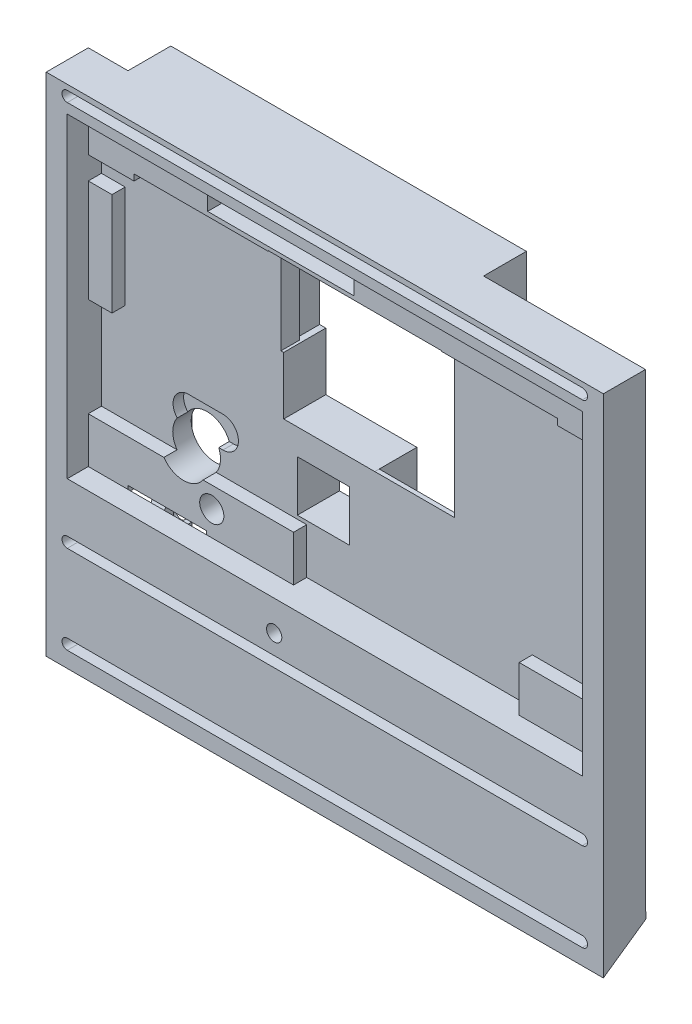
from build123d import *
from OCP.BRepFilletAPI import BRepFilletAPI_MakeChamfer

# Parameters (mm, degrees)
SKETCH1_W                       = 67.57
SKETCH1_H                       = 82.04
SKETCH1_W_2                     = 59.57
SKETCH1_H_2                     = 74.04
BOSS_EXTRUDE1_DEPTH             = 12.13
SKETCH2_W                       = 5.056332521
SKETCH2_H                       = 8.11
SKETCH2_W_2                     = 9.886324902
SKETCH2_H_2                     = 9.628245149
SKETCH2_W_3                     = 4.14
SKETCH2_H_3                     = 7
BOSS_EXTRUDE2_DEPTH             = 10.5
SKETCH3_R                       = 3.295
SKETCH3_W                       = 5.07
SKETCH3_H                       = 8.08
CUT_EXTRUDE1_DEPTH              = 4
SKETCH4_R                       = 4.538968619
SKETCH4_R_2                     = 2.296660374
BOSS_EXTRUDE3_DEPTH             = 6
SKETCH6_W                       = 4.2
SKETCH6_H                       = 5.9
CUT_EXTRUDE2_DEPTH              = 4
SKETCH5_W                       = 15.17
SKETCH5_H                       = 32.216758372
BOSS_EXTRUDE5_DEPTH             = 3.33
CUT_EXTRUDE3_DEPTH              = 4.5
SKETCH8_W                       = 3.54
SKETCH8_H                       = 60.01
SKETCH8_W_2                     = 26.76
BOSS_EXTRUDE6_DEPTH             = 4
SKETCH8_3_W                     = 105.87
SKETCH8_3_H                     = 82.04
SKETCH8_3_W_2                   = 97.87
SKETCH8_3_H_2                   = 60.01
BOSS_EXTRUDE7_DEPTH             = 4
SKETCH9_R                       = 1.449406475
CUT_EXTRUDE4_DEPTH              = 14.5
SKETCH10_W                      = 9.886324902
SKETCH10_H                      = 9.628245149
CUT_EXTRUDE5_DEPTH              = 2.5
SKETCH11_W                      = 16.344018588
SKETCH11_H                      = 10.97
CUT_EXTRUDE6_DEPTH              = 12.78
CUT_EXTRUDE7_START              = -10.104556
SKETCH12_R                      = 5
CUT_EXTRUDE7_DEPTH              = 10.104556
SKETCH13_W                      = 5.5
SKETCH13_H                      = 11
CUT_EXTRUDE8_DEPTH              = 2
CHAMFER1_SIZE                   = 0.352653961
CHAMFER1_SIZE_2                 = 2
SKETCH15_W                      = 8.13
SKETCH15_H                      = 12.312258352
CUT_EXTRUDE9_DEPTH              = 3.75
CHAMFER2_SIZE                   = 6.92820323
CHAMFER2_SIZE_2                 = 4
FILLET1_R                       = 10
CUT_EXTRUDE10_DEPTH             = 2
BOSS_EXTRUDE8_REACH             = 131.072
BOSS_EXTRUDE8_DIRECTION_2_REACH = 131.072
BOSS_EXTRUDE9_DEPTH             = 67.57
SKETCH22_R                      = 1
CUT_EXTRUDE11_DEPTH             = 15
BOSS_EXTRUDE10_REACH            = 137.716
CUT_EXTRUDE14_REACH             = 129.823
CUT_EXTRUDE14_END_RADIUS        = 1
SKETCH25_W                      = 11
SKETCH25_H                      = 2
CUT_EXTRUDE15_DEPTH             = 9.047267
CUT_EXTRUDE17_DEPTH             = 2


# Some blends are built 0.0001 mm under size
with BuildPart() as part:
    # Sketch1 → Boss-Extrude1 (new body)
    with BuildSketch(Plane.XY):
        with Locations((33.785, 41.02)):
            Rectangle(SKETCH1_W, SKETCH1_H)
        with Locations((33.785, 41.02)):
            Rectangle(SKETCH1_W_2, SKETCH1_H_2, mode=Mode.SUBTRACT)
    extrude(amount=BOSS_EXTRUDE1_DEPTH)

    # Sketch2 → Boss-Extrude2 (add)
    # profile 1 of 3: a face of its own
    with BuildSketch(Plane.XY.offset(12.13)):
        Polygon((63.57, 4), (63.57, 8.81), (48.4, 8.81), (48.4, 41.02), (31.09, 41.02), (31.09, 42.65), (31.09, 51.980736011), (29.91, 51.980736011), (29.91, 69.76), (46.97, 69.76), (63.57, 69.76), (63.57, 78.04), (46.97, 78.04), (46.97, 70.46), (19.884173984, 70.46), (19.884173984, 65.974782106), (23.4, 65.974782106), (23.4, 62.189564213), (19.884173984, 62.189564213), (19.884173984, 57.7), (17.69, 57.7), (17.69, 55.75345319), (12.048971612, 55.75345319), (12.048971612, 53.7), (9.384343354, 53.7), (9.384343354, 57.7), (4, 57.7), (4, 52.67), (21.97, 52.67), (21.97, 57.934249496), (27.48, 57.934249496), (27.48, 52.67), (27.48, 41.02), (21.97, 41.02), (21.97, 25.27), (30.576891618, 25.27), (30.576891618, 8.81), (18.908573992, 8.81), (18.908573992, 4), align=None)
        with Locations((35.59281061, 12.865)):
            Rectangle(SKETCH2_W, SKETCH2_H, mode=Mode.SUBTRACT)
        with Locations((38.626837549, 31.304322193)):
            Rectangle(SKETCH2_W_2, SKETCH2_H_2, mode=Mode.SUBTRACT)
    # profile 2 of 3: a face of its own
    with BuildSketch(Plane.XY.offset(12.13)):
        with Locations((17.07, 74.54)):
            Rectangle(SKETCH2_W_3, SKETCH2_H_3)
    # profile 3 of 3: a face of its own
    with BuildSketch(Plane.XY.offset(12.13)):
        with BuildLine():
            Line((4, 36.69), (4, 30.56))
            Line((4, 30.56), (10.54, 30.56))
            ThreePointArc((10.54, 30.56), (12.890078171, 32.732190681), (16.09, 32.69))
            Line((16.09, 32.69), (16.09, 36.69))
            Line((16.09, 36.69), (4, 36.69))
        make_face()
    extrude(amount=-BOSS_EXTRUDE2_DEPTH)

    # Sketch3 → Cut-Extrude1 (cut)
    with BuildSketch(Plane.ZY):
        with Locations((8.175, 12.315)):
            Circle(SKETCH3_R)
        with Locations((2.535, 64.62)):
            Rectangle(SKETCH3_W, SKETCH3_H)
    extrude(amount=-CUT_EXTRUDE1_DEPTH, mode=Mode.SUBTRACT)

    # Sketch4 → Boss-Extrude3 (add)
    with BuildSketch(Plane.XY.offset(12.13)):
        Polygon((4, 70.46), (14.88607029, 70.46), (15, 78.04), (19.14, 78.04), (19.14, 70.46), (30.576891618, 70.46), (30.576891618, 4), (4, 4), (4, 6.83), (18.908573992, 6.83), (18.908573992, 17.8), (4, 17.8), align=None)
        with Locations((14.544107927, 28.422394838)):
            Circle(SKETCH4_R, mode=Mode.SUBTRACT)
        with Locations((19.919655023, 21.845034344)):
            Circle(SKETCH4_R_2, mode=Mode.SUBTRACT)
    extrude(amount=-BOSS_EXTRUDE3_DEPTH)

    # Sketch6 → Cut-Extrude2 (cut)
    with BuildSketch(Plane(origin=(67.57, 0, 0), x_dir=(0, 0, -1), z_dir=(1, 0, 0))):
        with Locations((-4.55, 15.67)):
            Rectangle(SKETCH6_W, SKETCH6_H)
    extrude(amount=-CUT_EXTRUDE2_DEPTH, mode=Mode.SUBTRACT)

    # Sketch5 → Boss-Extrude5 (add)
    with BuildSketch(Plane.XY.offset(12.13)):
        with Locations((55.985, 24.918379186)):
            Rectangle(SKETCH5_W, SKETCH5_H)
    extrude(amount=-BOSS_EXTRUDE5_DEPTH)

    # Sketch7 → Cut-Extrude3 (cut)
    with BuildSketch(Plane.XY.offset(12.13)):
        with BuildLine():
            Line((19.54, 30.142877743), (13.02, 30.142877743))
            ThreePointArc((13.02, 30.142877743), (10.072877743, 33.09), (13.02, 36.037122257))
            Line((13.02, 36.037122257), (19.54, 36.037122257))
            ThreePointArc((19.54, 36.037122257), (22.487122257, 33.09), (19.54, 30.142877743))
        make_face()
    extrude(amount=-CUT_EXTRUDE3_DEPTH, mode=Mode.SUBTRACT)

    # Sketch8 → Boss-Extrude6 (add)
    with BuildSketch(Plane.XY.offset(12.13)):
        Polygon((-3.54, 77.14), (0, 77.14), (0, 82.04), (-7.54, 82.04), (-7.54, 0), (0, 0), (0, 17.13), (-3.54, 17.13), align=None)
        with Locations((-1.77, 47.135)):
            Rectangle(SKETCH8_W, SKETCH8_H)
        Polygon((98.33, 82.04), (67.57, 82.04), (67.57, 77.14), (94.33, 77.14), (94.33, 17.13), (67.57, 17.13), (67.57, 0), (98.33, 0), align=None)
        with Locations((80.95, 47.135)):
            Rectangle(SKETCH8_W_2, SKETCH8_H)
    extrude(amount=-BOSS_EXTRUDE6_DEPTH)

    # Sketch8<3> → Boss-Extrude7 (add)
    with BuildSketch(Plane.XY.offset(12.13)):
        with Locations((45.395, 41.02)):
            Rectangle(SKETCH8_3_W, SKETCH8_3_H)
        with Locations((45.395, 47.135)):
            Rectangle(SKETCH8_3_W_2, SKETCH8_3_H_2, mode=Mode.SUBTRACT)
    extrude(amount=BOSS_EXTRUDE7_DEPTH)

    # Sketch9 → Cut-Extrude4 (cut)
    with BuildSketch(Plane.XY.offset(16.13)):
        with Locations((35.780517138, 11.382044907)):
            Circle(SKETCH9_R)
    extrude(amount=-CUT_EXTRUDE4_DEPTH, mode=Mode.SUBTRACT)

    # Sketch10 → Cut-Extrude5 (cut)
    with BuildSketch(Plane.XY.offset(12.13)):
        with BuildLine():
            Line((5.15, 68.45), (-3.54, 68.45))
            Line((-3.54, 68.45), (-3.54, 64.13))
            Line((-3.54, 64.13), (0.96, 64.13))
            Line((0.96, 64.13), (0.96, 44.63))
            Line((0.96, 44.63), (-3.54, 44.63))
            Line((-3.54, 44.63), (-3.54, 25.82))
            Line((-3.54, 25.82), (10.825267082, 25.82))
            ThreePointArc((10.825267082, 25.82), (10.005266117, 28.456323299), (10.864586998, 31.080093438))
            ThreePointArc((10.864586998, 31.080093438), (10.317318927, 34.265178547), (13.02, 36.037122257))
            Line((13.02, 36.037122257), (19.54, 36.037122257))
            ThreePointArc((19.54, 36.037122257), (22.487122257, 33.09), (19.54, 30.142877743))
            Line((19.54, 30.142877743), (18.744366811, 30.142877743))
            ThreePointArc((18.744366811, 30.142877743), (19.055189075, 27.920017493), (18.262948772, 25.82))
            Line((18.262948772, 25.82), (35.46, 25.82))
            Line((35.46, 25.82), (35.46, 17.13))
            Line((35.46, 17.13), (78.33, 17.13))
            Line((78.33, 17.13), (78.33, 25.82))
            Line((78.33, 25.82), (94.33, 25.82))
            Line((94.33, 25.82), (94.33, 35.13))
            Line((94.33, 35.13), (91.33, 35.13))
            Line((91.33, 35.13), (91.33, 47.135))
            Line((91.33, 47.135), (91.33, 57.13))
            Line((91.33, 57.13), (94.33, 57.13))
            Line((94.33, 57.13), (94.33, 68.45))
            Line((94.33, 68.45), (85.64, 68.45))
            Line((85.64, 68.45), (85.64, 69.64))
            Line((85.64, 69.64), (63.57, 69.64))
            Line((63.57, 69.64), (63.57, 41.026758372))
            Line((63.57, 41.026758372), (48.4, 41.026758372))
            Line((48.4, 41.026758372), (48.4, 41.02))
            Line((48.4, 41.02), (31.09, 41.02))
            Line((31.09, 41.02), (31.09, 51.980736011))
            Line((31.09, 51.980736011), (30.576891618, 51.980736011))
            Line((30.576891618, 51.980736011), (30.576891618, 69.64))
            Line((30.576891618, 69.64), (5.15, 69.64))
            Line((5.15, 69.64), (5.15, 68.45))
        make_face()
        with Locations((38.626837549, 31.304322193)):
            Rectangle(SKETCH10_W, SKETCH10_H, mode=Mode.SUBTRACT)
    extrude(amount=-CUT_EXTRUDE5_DEPTH, mode=Mode.SUBTRACT)

    # Sketch11 → Cut-Extrude6 (cut)
    with BuildSketch(Plane(origin=(0, 0, 0), x_dir=(-1, 0, 0), z_dir=(0, 0, -1))):
        with Locations((-10.736564698, 11.18)):
            Rectangle(SKETCH11_W, SKETCH11_H)
    extrude(amount=-CUT_EXTRUDE6_DEPTH, mode=Mode.SUBTRACT)

    # Sketch12 → Cut-Extrude7 (cut)
    with BuildSketch(Plane.ZY.offset(7.54).offset(CUT_EXTRUDE7_START)):
        with Locations(Location((8.13, 11.18, 0), (0, 0, 338.434814985))):
            Circle(SKETCH12_R)
    extrude(amount=CUT_EXTRUDE7_DEPTH, mode=Mode.SUBTRACT)

    # Sketch13 → Cut-Extrude8 (cut)
    with BuildSketch(Plane.ZY):
        with Locations((3.35, 64.62)):
            Rectangle(SKETCH13_W, SKETCH13_H)
    extrude(amount=-CUT_EXTRUDE8_DEPTH, mode=Mode.SUBTRACT)

    # Chamfer1
    chamfer1_edges_1 = [part.edges().sort_by_distance(p)[0] for p in [
        (0, 59.85, 0.6),
    ]]
    chamfer1_side_1 = [part.faces().sort_by_distance(p)[0] for p in [
        (0, 59.85, 0.592946921),
    ]]
    chamfer1_edges_2 = [part.edges().sort_by_distance(p)[0] for p in [
        (0, 69.39, 0.6),
    ]]
    chamfer1_side_2 = [part.faces().sort_by_distance(p)[0] for p in [
        (0, 69.39, 0.592946921),
    ]]
    chamfer1_edges_3 = [part.edges().sort_by_distance(p)[0] for p in [
        (0, 70.12, 3.35),
    ]]
    chamfer1_side_3 = [part.faces().sort_by_distance(p)[0] for p in [
        (0, 70.127053079, 3.35),
    ]]
    chamfer1_edges_4 = [part.edges().sort_by_distance(p)[0] for p in [
        (0, 59.12, 3.35),
    ]]
    chamfer1_side_4 = [part.faces().sort_by_distance(p)[0] for p in [
        (0, 59.112946921, 3.35),
    ]]
    chamfer1_edges_5 = [part.edges().sort_by_distance(p)[0] for p in [
        (0, 64.62, 6.1),
    ]]
    chamfer1_side_5 = [part.faces().sort_by_distance(p)[0] for p in [
        (0, 64.62, 6.107053079),
    ]]
    chamfer1 = BRepFilletAPI_MakeChamfer(part.part.solid().wrapped)
    for e in chamfer1_edges_1:
        chamfer1.Add(CHAMFER1_SIZE - 0.0001, CHAMFER1_SIZE_2 - 0.0001, e.wrapped, chamfer1_side_1[0].wrapped)
    for e in chamfer1_edges_2:
        chamfer1.Add(CHAMFER1_SIZE - 0.0001, CHAMFER1_SIZE_2 - 0.0001, e.wrapped, chamfer1_side_2[0].wrapped)
    for e in chamfer1_edges_3:
        chamfer1.Add(CHAMFER1_SIZE - 0.0001, CHAMFER1_SIZE_2 - 0.0001, e.wrapped, chamfer1_side_3[0].wrapped)
    for e in chamfer1_edges_4:
        chamfer1.Add(CHAMFER1_SIZE - 0.0001, CHAMFER1_SIZE_2 - 0.0001, e.wrapped, chamfer1_side_4[0].wrapped)
    for e in chamfer1_edges_5:
        chamfer1.Add(CHAMFER1_SIZE - 0.0001, CHAMFER1_SIZE_2 - 0.0001, e.wrapped, chamfer1_side_5[0].wrapped)
    add(Compound.cast(chamfer1.Shape()), mode=Mode.REPLACE)  # a hair under: the kernel refuses the full size

    # Sketch15 → Cut-Extrude9 (cut)
    with BuildSketch(Plane(origin=(67.57, 0, 0), x_dir=(0, 0, -1), z_dir=(1, 0, 0))):
        with Locations((-4.065, 15.67)):
            Rectangle(SKETCH15_W, SKETCH15_H)
    extrude(amount=-CUT_EXTRUDE9_DEPTH, mode=Mode.SUBTRACT)

    # Chamfer2
    # the kernel refuses this chamfer: 6.92820323, 4 mm, written as the material it takes off along each edge
    with BuildSketch(Plane(origin=(67.57, 21.826129176, 8.13), x_dir=(0.019326765612699703, 0.9998132206222079, 0), z_dir=(0, 0, -1))) as chamfer2_piece_1_section:
        Polygon((CHAMFER2_SIZE * 0.999813220662, -CHAMFER2_SIZE * 0.0193267656135), (-CHAMFER2_SIZE_2 * 0.0193267656127, -CHAMFER2_SIZE_2 * 0.999813220622), (0, 0), align=None)
    chamfer2_piece_1 = extrude(amount=26.053855882, mode=Mode.PRIVATE)
    chamfer2_piece_1 = split(chamfer2_piece_1, bisect_by=Plane(origin=(63.82, 24.144020698, 4.065), z_dir=(1, 0, 0)), keep=Keep.TOP, mode=Mode.PRIVATE)
    add(chamfer2_piece_1, mode=Mode.SUBTRACT)
    with BuildSketch(Plane(origin=(67.57, 9.513870824, -17.923855882), x_dir=(-0.9983227437537926, 0.05789386240267147, 0), z_dir=(0, 0, 1))) as chamfer2_piece_2_section:
        Polygon((CHAMFER2_SIZE_2 * 0.998322743754, CHAMFER2_SIZE_2 * 0.0578938624027), (-CHAMFER2_SIZE * 0.057893862405, CHAMFER2_SIZE * 0.998322743793), (0, 0), align=None)
    chamfer2_piece_2 = extrude(amount=26.053855882, mode=Mode.PRIVATE)
    chamfer2_piece_2 = split(chamfer2_piece_2, bisect_by=Plane(origin=(63.82, 7.195979302, 4.065), z_dir=(1, 0, 0)), keep=Keep.TOP, mode=Mode.PRIVATE)
    add(chamfer2_piece_2, mode=Mode.SUBTRACT)

    # Fillet1
    # the kernel refuses this fillet: 10 mm, written as the material it takes off along each edge
    with BuildSketch(Plane(origin=(67.57, 28.754332406, 8.13), x_dir=(-0.5000000000001512, -0.8660254037843514, 0), z_dir=(0, 0, -1))) as fillet1_piece_1:
        with BuildLine():
            CenterArc((FILLET1_R * 0.267949192431, FILLET1_R), FILLET1_R, 240, 30)
            Line((-FILLET1_R * 0.232050807569, FILLET1_R * 0.133974596216), (0, 0))
            Line((0, 0), (FILLET1_R * 0.267949192431, 0))
        make_face()
    extrude(amount=14.828729811, mode=Mode.SUBTRACT)
    with BuildSketch(Plane(origin=(67.57, 2.585667594, -6.698729811), x_dir=(0, -1, 0), z_dir=(0, 0, 1))) as fillet1_piece_2:
        with BuildLine():
            CenterArc((FILLET1_R * 0.267949192431, -FILLET1_R), FILLET1_R, 90, 30)
            Line((-FILLET1_R * 0.232050807569, -FILLET1_R * 0.133974596216), (0, 0))
            Line((0, 0), (FILLET1_R * 0.267949192431, 0))
        make_face()
    extrude(amount=14.828729811, mode=Mode.SUBTRACT)

    # Sketch18 → Cut-Extrude10 (cut)
    with BuildSketch(Plane(origin=(0, 0, 0), x_dir=(-1, 0, 0), z_dir=(0, 0, -1))):
        with BuildLine():
            Line((-65.57, 81.04), (-2, 81.04))
            ThreePointArc((-2, 81.04), (-1, 80.04), (-2, 79.04))
            Line((-2, 79.04), (-65.57, 79.04))
            ThreePointArc((-65.57, 79.04), (-66.57, 80.04), (-65.57, 81.04))
        make_face()
        with BuildLine():
            Line((-66.57, 28.993934719), (-66.57, 74.588686402))
            ThreePointArc((-66.57, 74.588686402), (-65.57, 75.588686402), (-64.57, 74.588686402))
            Line((-64.57, 74.588686402), (-64.57, 28.993934719))
            ThreePointArc((-64.57, 28.993934719), (-65.57, 27.993934719), (-66.57, 28.993934719))
        make_face()
        with BuildLine():
            Line((-65.57, 1), (-2, 1))
            ThreePointArc((-2, 1), (-1, 2), (-2, 3))
            Line((-2, 3), (-65.57, 3))
            ThreePointArc((-65.57, 3), (-66.57, 2), (-65.57, 1))
        make_face()
        with BuildLine():
            Line((-3, 6.109784189), (-3, 57.767346039))
            ThreePointArc((-3, 57.767346039), (-2, 58.767346039), (-1, 57.767346039))
            Line((-1, 57.767346039), (-1, 6.109784189))
            ThreePointArc((-1, 6.109784189), (-2, 5.109784189), (-3, 6.109784189))
        make_face()
        with BuildLine():
            Line((-1, 71.472653961), (-1, 74.588686402))
            ThreePointArc((-1, 74.588686402), (-2, 75.588686402), (-3, 74.588686402))
            Line((-3, 74.588686402), (-3, 71.472653961))
            ThreePointArc((-3, 71.472653961), (-2, 70.472653961), (-1, 71.472653961))
        make_face()
    extrude(amount=-CUT_EXTRUDE10_DEPTH, mode=Mode.SUBTRACT)

    # Boss-Extrude8: up to this face of the body (flat: up to its plane)
    boss_extrude8_end = Plane(part.part.faces().sort_by_distance((-7.54, 42.919058237, 12.249514283))[0])
    # Sketch21 → Boss-Extrude8 (add, up to the picked face)
    with BuildSketch(Plane.ZY, mode=Mode.PRIVATE) as boss_extrude8_sk1:
        Polygon((16.13, -14.1), (16.13, 0), (8.13, 0), (8.065, -8.45), align=None)
    boss_extrude8_tool1 = split(extrude(boss_extrude8_sk1.sketch, amount=BOSS_EXTRUDE8_REACH, mode=Mode.PRIVATE), bisect_by=boss_extrude8_end, keep=Keep.BOTH, mode=Mode.PRIVATE)
    add(boss_extrude8_tool1.solids().sort_by(Axis((0, -5.764372, 12.447457), (-1, 0, 0)))[0])

    # Boss-Extrude8 direction 2: up to this face of the body (flat: up to its plane)
    boss_extrude8_direction_2_end = Plane(part.part.faces().sort_by_distance((98.33, 41.02, 12.13))[0])
    # Sketch21 → Boss-Extrude8 direction 2 (add, up to the picked face)
    with BuildSketch(Plane.ZY, mode=Mode.PRIVATE) as boss_extrude8_direction_2_sk1:
        Polygon((16.13, -14.1), (16.13, 0), (8.13, 0), (8.065, -8.45), align=None)
    boss_extrude8_direction_2_tool1 = split(extrude(boss_extrude8_direction_2_sk1.sketch, amount=-BOSS_EXTRUDE8_DIRECTION_2_REACH, mode=Mode.PRIVATE), bisect_by=boss_extrude8_direction_2_end, keep=Keep.BOTH, mode=Mode.PRIVATE)
    add(boss_extrude8_direction_2_tool1.solids().sort_by(Axis((0, -5.764372, 12.447457), (1, 0, 0)))[0])

    # Sketch21<3> → Boss-Extrude9 (add)
    with BuildSketch(Plane.ZY):
        Polygon((8.065, -8.45), (8.13, 0), (0, 0), (0, -2.8), align=None)
    extrude(amount=-BOSS_EXTRUDE9_DEPTH)

    # Sketch22 → Cut-Extrude11 (cut)
    with BuildSketch(Plane.ZY):
        with Locations((4.88, 74.54)):
            Circle(SKETCH22_R)
    extrude(amount=-CUT_EXTRUDE11_DEPTH, mode=Mode.SUBTRACT)

    # Boss-Extrude10: up to this face of the body (flat: up to its plane)
    boss_extrude10_end = Plane(part.part.faces().sort_by_distance((9.443035145, 70.46, 9.13))[0])
    # Sketch23 → Boss-Extrude10 (add, up to the picked face)
    with BuildSketch(Plane.XZ.offset(-78.04), mode=Mode.PRIVATE) as boss_extrude10_sk1:
        Polygon((15, 12.13), (15, 2.909475325), (4, 9.047266551), (4, 12.13), align=None)
    boss_extrude10_tool1 = split(extrude(boss_extrude10_sk1.sketch, amount=BOSS_EXTRUDE10_REACH, mode=Mode.PRIVATE), bisect_by=boss_extrude10_end, keep=Keep.BOTH, mode=Mode.PRIVATE)
    add(boss_extrude10_tool1.solids().sort_by(Axis((10.414605, 78.04, 8.799019), (0, -1, 0)))[0])

    # Cut-Extrude14: up to this cylinder (the profile starts outside it)
    cut_extrude14_end = Plane(origin=(5.94, 74.54, 4.88), z_dir=(-1, 0, 0)) * Cylinder(CUT_EXTRUDE14_END_RADIUS, 262.646, mode=Mode.PRIVATE)
    # Sketch24 → Cut-Extrude14 (cut, up to the surface)
    with BuildSketch(Plane(origin=(2, 0, -2), x_dir=(0, -1, 0), z_dir=(0.7071067811865464, 0, -0.7071067811865488)), mode=Mode.PRIVATE) as cut_extrude14_sk1:
        with BuildLine():
            Line((-73.54, -4.864894655), (-73.54, -6.279108217))
            add(Edge.make_bspline(
                [(-75.54, -6.279108217), (-75.54, -6.986214998), (-74.54, -6.986214998), (-73.54, -6.986214998), (-73.54, -6.279108217)],
                knots=[3.141592654, 3.141592654, 3.141592654, 4.71238898, 4.71238898, 6.283185307, 6.283185307, 6.283185307], degree=2, weights=[1, 0.707106781, 1, 0.707106781, 1]))
            Line((-75.54, -6.279108217), (-75.54, -4.864894655))
            add(Edge.make_bspline(
                [(-73.54, -4.864894655), (-73.54, -4.157787873), (-74.54, -4.157787873), (-75.54, -4.157787873), (-75.54, -4.864894655)],
                knots=[0, 0, 0, 1.570796327, 1.570796327, 3.141592654, 3.141592654, 3.141592654], degree=2, weights=[1, 0.707106781, 1, 0.707106781, 1]))
        make_face()
    cut_extrude14_tool1 = extrude(cut_extrude14_sk1.sketch, amount=-CUT_EXTRUDE14_REACH, mode=Mode.PRIVATE) - cut_extrude14_end
    add(cut_extrude14_tool1.solids().sort_by_distance((5.94, 74.54, 1.94))[0], mode=Mode.SUBTRACT)

    # Sketch25 → Cut-Extrude15 (cut)
    with BuildSketch(Plane(origin=(0, 0, 0), x_dir=(-1, 0, 0), z_dir=(0, 0, -1))):
        with Locations((-9.5, 74.54)):
            Rectangle(SKETCH25_W, SKETCH25_H)
    extrude(amount=-CUT_EXTRUDE15_DEPTH, mode=Mode.SUBTRACT)

    # Sketch28 → Cut-Extrude17 (cut)
    with BuildSketch(Plane.XY.offset(16.13)):
        with BuildLine():
            Line((-3.54, 79.04), (94.33, 79.04))
            ThreePointArc((94.33, 79.04), (95.33, 80.04), (94.33, 81.04))
            Line((94.33, 81.04), (-3.54, 81.04))
            ThreePointArc((-3.54, 81.04), (-4.54, 80.04), (-3.54, 79.04))
        make_face()
        with BuildLine():
            Line((94.33, -9.1), (-3.54, -9.1))
            ThreePointArc((-3.54, -9.1), (-4.54, -10.1), (-3.54, -11.1))
            Line((-3.54, -11.1), (94.33, -11.1))
            ThreePointArc((94.33, -11.1), (95.33, -10.1), (94.33, -9.1))
        make_face()
        with BuildLine():
            Line((-3.54, 5.67932863), (94.33, 5.67932863))
            ThreePointArc((94.33, 5.67932863), (95.33, 6.67932863), (94.33, 7.67932863))
            Line((94.33, 7.67932863), (-3.54, 7.67932863))
            ThreePointArc((-3.54, 7.67932863), (-4.54, 6.67932863), (-3.54, 5.67932863))
        make_face()
    extrude(amount=-CUT_EXTRUDE17_DEPTH, mode=Mode.SUBTRACT)


solid = part.part
